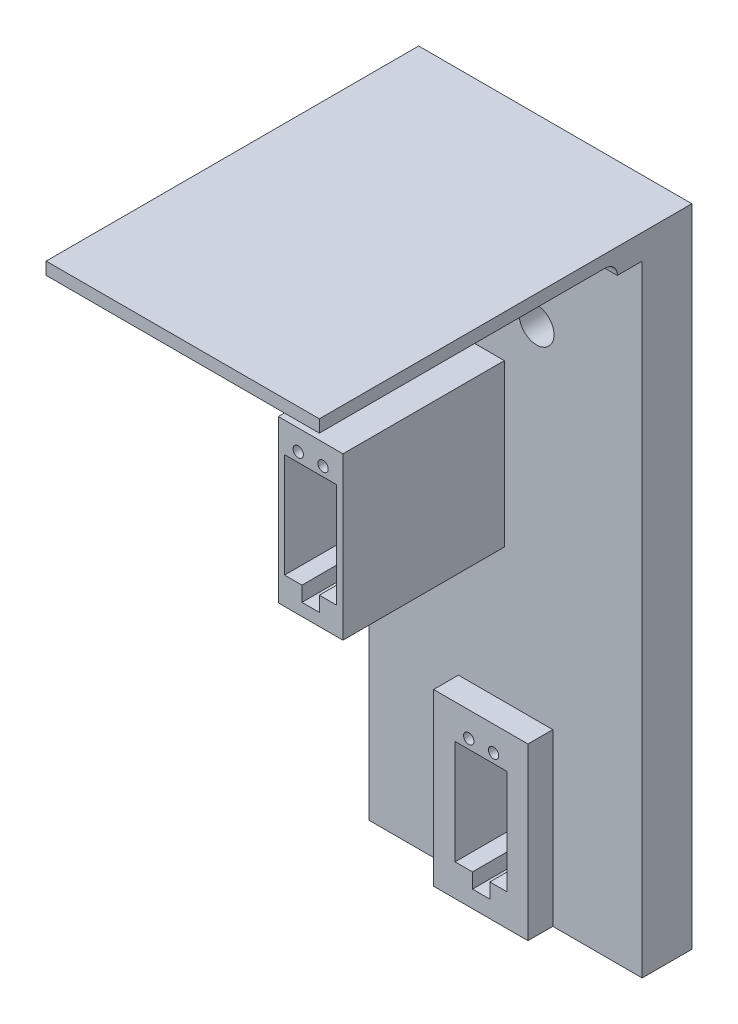
from build123d import *

# Parameters (mm, degrees)
SKETCH1_W           = 150
SKETCH1_H           = 200
BOSS_EXTRUDE1_DEPTH = 30
SKETCH2_W           = 150
SKETCH2_H           = 5
BOSS_EXTRUDE2_DEPTH = 120
SKETCH3_R           = 1.65
CUT_EXTRUDE3_DEPTH  = 80
SKETCH6_R           = 5
CUT_EXTRUDE5_DEPTH  = 22
SKETCH7_R           = 1.925
CUT_EXTRUDE6_DEPTH  = 5
FILLET1_R           = 5
SKETCH9_R           = 2.08
CUT_EXTRUDE7_DEPTH  = 30
BOSS_EXTRUDE5_START = -85
SKETCH12_R          = 2.08
BOSS_EXTRUDE5_DEPTH = 85
SKETCH13_W          = 150
SKETCH13_H          = 60
BOSS_EXTRUDE6_DEPTH = 30
SKETCH15_R          = 2.08
CUT_EXTRUDE8_DEPTH  = 30
SKETCH16_R          = 7
CUT_EXTRUDE9_DEPTH  = 22
SKETCH17_W          = 20
SKETCH17_H          = 260
CUT_EXTRUDE10_DEPTH = 150
SKETCH19_W          = 26
SKETCH19_H          = 65
CUT_EXTRUDE11_DEPTH = 10


with BuildPart() as part:
    # Sketch1 → Boss-Extrude1 (new body)
    with BuildSketch(Plane.XY):
        Rectangle(SKETCH1_W, SKETCH1_H)
    extrude(amount=BOSS_EXTRUDE1_DEPTH)

    # Sketch2 → Boss-Extrude2 (add)
    with BuildSketch(Plane.XY.offset(30)):
        with Locations((0, 97.5)):
            Rectangle(SKETCH2_W, SKETCH2_H)
    extrude(amount=BOSS_EXTRUDE2_DEPTH)

    # Sketch3 → Cut-Extrude3 (cut)
    with BuildSketch(Plane.XY.offset(30)):
        with Locations((-12.5, 46.5)):
            Circle(SKETCH3_R)
        with Locations((12.5, 46.5)):
            Circle(SKETCH3_R)
        with Locations((-12.5, 71.5)):
            Circle(SKETCH3_R)
        with Locations((12.5, 71.5)):
            Circle(SKETCH3_R)
    extrude(amount=-CUT_EXTRUDE3_DEPTH, mode=Mode.SUBTRACT)

    # Sketch6 → Cut-Extrude5 (cut)
    with BuildSketch(Plane.XY.offset(30)):
        with Locations((-12.5, 71.5)):
            Circle(SKETCH6_R)
        with Locations((12.5, 71.5)):
            Circle(SKETCH6_R)
        with Locations((-12.5, 46.5)):
            Circle(SKETCH6_R)
        with Locations((12.5, 46.5)):
            Circle(SKETCH6_R)
    extrude(amount=-CUT_EXTRUDE5_DEPTH, mode=Mode.SUBTRACT)

    # Sketch7 → Cut-Extrude6 (cut)
    with BuildSketch(Plane.XY.offset(8)):
        with Locations((-12.5, 71.5)):
            Circle(SKETCH7_R)
        with Locations((12.5, 71.5)):
            Circle(SKETCH7_R)
        with Locations((-12.5, 46.5)):
            Circle(SKETCH7_R)
        with Locations((12.5, 46.5)):
            Circle(SKETCH7_R)
    extrude(amount=-CUT_EXTRUDE6_DEPTH, mode=Mode.SUBTRACT)

    # Fillet1
    fillet1_edges = [part.edges().sort_by_distance(p)[0] for p in [
        (0, 95, 30),
    ]]
    fillet(fillet1_edges, radius=FILLET1_R)

    # Sketch9 → Cut-Extrude7 (cut)
    with BuildSketch(Plane.XY.offset(30)):
        Polygon((-3, -26.5), (-3, 15.5), (-24, 15.5), (-24, -26.5), (-17, -26.5), (-17, -32.5), (-10, -32.5), (-10, -26.5), align=None)
        with Locations((-8.5, 19.25)):
            Circle(SKETCH9_R)
        with Locations((-18.5, 19.25)):
            Circle(SKETCH9_R)
    extrude(amount=-CUT_EXTRUDE7_DEPTH, mode=Mode.SUBTRACT)

    # Sketch12 → Boss-Extrude5 (add)
    with BuildSketch(Plane(origin=(0, 0, 0), x_dir=(-1, 0, 0), z_dir=(0, 0, -1)).offset(BOSS_EXTRUDE5_START)):
        Polygon((0.5, -37.461410483), (13.5, -37.461410483), (26.5, -37.461410483), (26.5, 27.538589517), (0.5, 27.538589517), align=None)
        Polygon((3, 15.5), (13.5, 15.5), (24, 15.5), (24, -26.5), (17, -26.5), (17, -32.5), (13.5, -32.5), (10, -32.5), (10, -26.5), (3, -26.5), align=None, mode=Mode.SUBTRACT)
        with Locations((8.5, 19.25)):
            Circle(SKETCH12_R, mode=Mode.SUBTRACT)
        with Locations((18.5, 19.25)):
            Circle(SKETCH12_R, mode=Mode.SUBTRACT)
    extrude(amount=BOSS_EXTRUDE5_DEPTH)

    # Sketch13 → Boss-Extrude6 (add)
    with BuildSketch(Plane(origin=(0, 0, 0), x_dir=(-1, 0, 0), z_dir=(0, 0, -1))):
        with Locations((0, -130)):
            Rectangle(SKETCH13_W, SKETCH13_H)
    extrude(amount=-BOSS_EXTRUDE6_DEPTH)

    # Sketch15 → Cut-Extrude8 (cut)
    with BuildSketch(Plane.XY.offset(30)):
        with Locations((-4.843183012, -101.421536398)):
            Circle(SKETCH15_R)
        with Locations((5.156816988, -101.421536398)):
            Circle(SKETCH15_R)
        Polygon((-10.343183012, -105.171536398), (10.656816988, -105.171536398), (10.656816988, -147.171536398), (3.656816988, -147.171536398), (3.656816988, -153.171536398), (-3.343183012, -153.171536398), (-3.343183012, -147.171536398), (-10.343183012, -147.171536398), align=None)
    extrude(amount=-CUT_EXTRUDE8_DEPTH, mode=Mode.SUBTRACT)

    # Sketch16 → Cut-Extrude9 (cut)
    with BuildSketch(Plane.XY.offset(30)):
        with Locations((-12.5, 71.5)):
            Circle(SKETCH16_R)
        with Locations((12.5, 71.5)):
            Circle(SKETCH16_R)
        with Locations((12.5, 46.5)):
            Circle(SKETCH16_R)
        with Locations((-12.5, 46.5)):
            Circle(SKETCH16_R)
    extrude(amount=-CUT_EXTRUDE9_DEPTH, mode=Mode.SUBTRACT)

    # Sketch17 → Cut-Extrude10 (cut)
    with BuildSketch(Plane(origin=(0, 0, 0), x_dir=(-1, 0, 0), z_dir=(0, 0, -1))):
        with Locations((65, -30)):
            Rectangle(SKETCH17_W, SKETCH17_H)
        with Locations((-65, -30)):
            Rectangle(SKETCH17_W, SKETCH17_H)
    extrude(amount=-CUT_EXTRUDE10_DEPTH, mode=Mode.SUBTRACT)

    # Sketch19 → Cut-Extrude11 (cut)
    with BuildSketch(Plane.XY.offset(30)):
        Polygon((-55, 90), (55, 90), (55, -160), (19, -160), (19, -91.388207499), (-19, -91.388207499), (-19, -160), (-55, -160), align=None)
        with Locations((-13.5, -4.961410483)):
            Rectangle(SKETCH19_W, SKETCH19_H, mode=Mode.SUBTRACT)
    extrude(amount=-CUT_EXTRUDE11_DEPTH, mode=Mode.SUBTRACT)


solid = part.part
